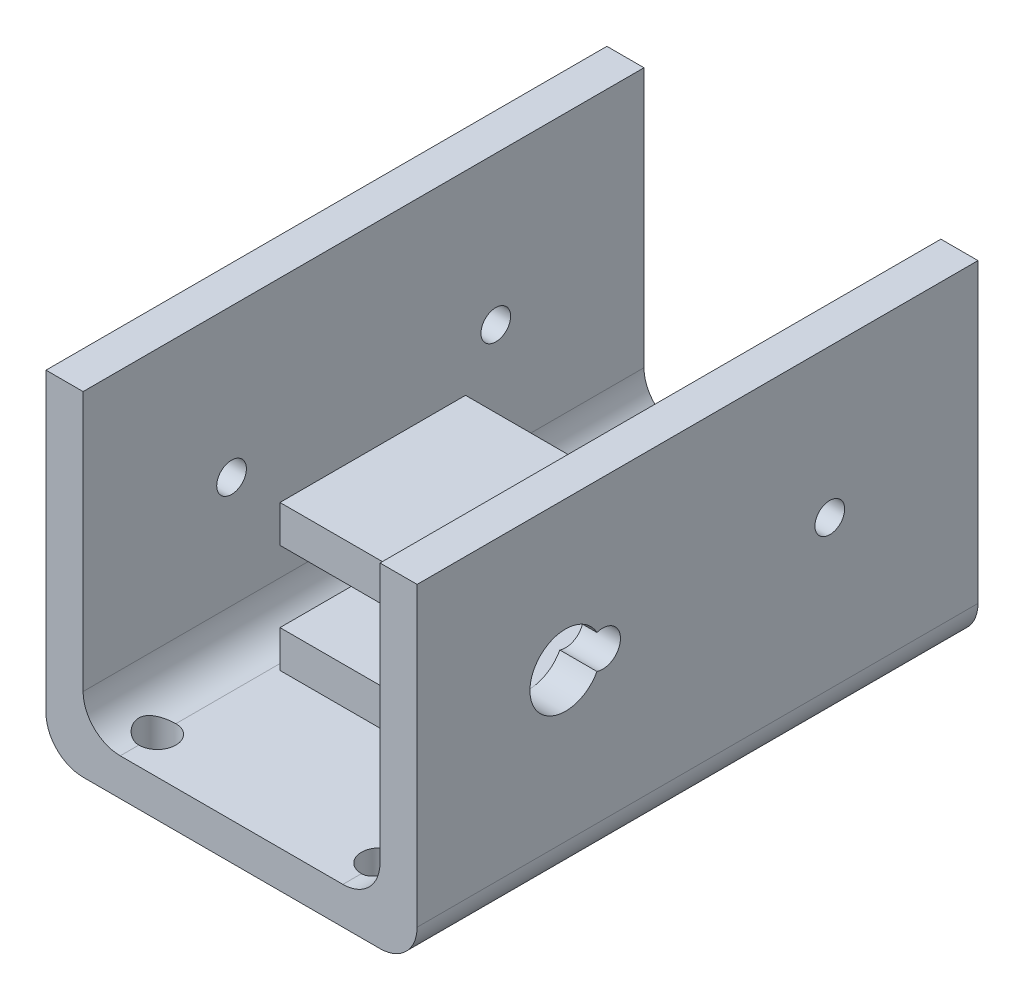
from build123d import *

# Parameters (mm, degrees)
SKETCH1_W           = 50.8
SKETCH1_H           = 95.972651844
SKETCH1_R           = 3.175
SKETCH1_R_2         = 3.81
BOSS_EXTRUDE1_DEPTH = 6.35
SKETCH1_3_W         = 6.35
SKETCH1_3_H         = 95.972651844
BOSS_EXTRUDE2_DEPTH = 57.15
FILLET1_R           = 6.35
SKETCH2_R           = 6.096
SKETCH2_R_2         = 2.54
SKETCH2_R_3         = 3.048
CUT_EXTRUDE1_DEPTH  = 6.35
CUT_EXTRUDE2_REACH  = 99.995
SKETCH2_4_R         = 2.54
SKETCH3_W           = 31.75
SKETCH3_H           = 6.35
BOSS_EXTRUDE4_DEPTH = 30.48


with BuildPart() as part:
    # Sketch1 → Boss-Extrude1 (new body)
    with BuildSketch(Plane(origin=(0, 0, 0), x_dir=(1, 0, 0), z_dir=(0, 1, 0))):
        with Locations((0, -0.019674078)):
            Rectangle(SKETCH1_W, SKETCH1_H)
        with Locations(Location((-19.05, -41.656, 0), (0, 0, 270))):
            Circle(SKETCH1_R, mode=Mode.SUBTRACT)
        with Locations(Location((19.05, -41.656, 0), (0, 0, 270))):
            Circle(SKETCH1_R, mode=Mode.SUBTRACT)
        with Locations(Location((-19.05, 41.616651844, 0), (0, 0, 270))):
            Circle(SKETCH1_R, mode=Mode.SUBTRACT)
        with Locations(Location((0, 0, 0), (0, 0, 270))):
            Circle(SKETCH1_R_2, mode=Mode.SUBTRACT)
        with Locations(Location((19.05, 41.616651844, 0), (0, 0, 270))):
            Circle(SKETCH1_R, mode=Mode.SUBTRACT)
    extrude(amount=BOSS_EXTRUDE1_DEPTH)

    # Sketch1<3> → Boss-Extrude2 (add)
    with BuildSketch(Plane(origin=(0, 0, 0), x_dir=(1, 0, 0), z_dir=(0, 1, 0))):
        with Locations((-28.575, -0.019674078)):
            Rectangle(SKETCH1_3_W, SKETCH1_3_H)
        with Locations((28.575, -0.019674078)):
            Rectangle(SKETCH1_3_W, SKETCH1_3_H)
    extrude(amount=BOSS_EXTRUDE2_DEPTH)

    # Fillet1
    # the kernel refuses this fillet: 6.35 mm, written as the material it adds along each edge
    with BuildSketch(Plane(origin=(25.4, 6.35, 48.006), x_dir=(0, 1, 0), z_dir=(0, 0, -1))) as fillet1_piece_1_section:
        with BuildLine():
            CenterArc((FILLET1_R, -FILLET1_R), FILLET1_R, 90, 90)
            Line((0, -FILLET1_R), (0, 0))
            Line((0, 0), (FILLET1_R, 0))
        make_face()
    fillet1_piece_1 = extrude(amount=95.972651844, mode=Mode.PRIVATE)
    fillet1_piece_1 = fillet1_piece_1 - Plane(origin=(19.05, 7.801972373, 41.656), x_dir=(0, 0, 1), z_dir=(0, -1, 0)) * Cylinder(3.175, 218, mode=Mode.PRIVATE)
    fillet1_piece_1 = fillet1_piece_1 - Plane(origin=(19.05, 7.801972373, -41.616651844), x_dir=(0, 0, 1), z_dir=(0, -1, 0)) * Cylinder(3.175, 218, mode=Mode.PRIVATE)
    add(fillet1_piece_1)
    with BuildSketch(Plane(origin=(-25.4, 6.35, -47.966651844), x_dir=(1, 0, 0), z_dir=(0, 0, 1))) as fillet1_piece_2_section:
        with BuildLine():
            CenterArc((FILLET1_R, FILLET1_R), FILLET1_R, 180, 90)
            Line((0, FILLET1_R), (0, 0))
            Line((0, 0), (FILLET1_R, 0))
        make_face()
    fillet1_piece_2 = extrude(amount=95.972651844, mode=Mode.PRIVATE)
    fillet1_piece_2 = fillet1_piece_2 - Plane(origin=(-19.05, 7.801971704, 41.656), x_dir=(0, 0, 1), z_dir=(0, -1, 0)) * Cylinder(3.175, 218, mode=Mode.PRIVATE)
    fillet1_piece_2 = fillet1_piece_2 - Plane(origin=(-19.05, 7.801971704, -41.616651844), x_dir=(0, 0, 1), z_dir=(0, -1, 0)) * Cylinder(3.175, 218, mode=Mode.PRIVATE)
    add(fillet1_piece_2)
    # the kernel refuses this fillet: 6.35 mm, written as the material it takes off along each edge
    with BuildSketch(Plane(origin=(-31.75, 0, -63.841651844), x_dir=(1, 0, 0), z_dir=(0, 0, 1)), Plane(origin=(31.75, 0, 63.881), x_dir=(-1, 0, 0), z_dir=(0, 0, -1))) as fillet1_2_piece_1:
        with BuildLine():
            CenterArc((FILLET1_R, FILLET1_R), FILLET1_R, 180, 90)
            Line((0, FILLET1_R), (0, 0))
            Line((0, 0), (FILLET1_R, 0))
        make_face()
    extrude(amount=127.722651844, mode=Mode.SUBTRACT)

    # Sketch2 → Cut-Extrude1 (cut)
    # profile 1 of 6: a face of its own
    with BuildSketch(Plane(origin=(31.75, 0, 0), x_dir=(0, 0, -1), z_dir=(1, 0, 0))):
        with Locations((-22.606, 31.75)):
            Circle(SKETCH2_R)
        with Locations((-22.606, 31.75)):
            Circle(SKETCH2_R_2, mode=Mode.SUBTRACT)
    # profile 2 of 6: a face of its own
    with BuildSketch(Plane(origin=(31.75, 0, 0), x_dir=(0, 0, -1), z_dir=(1, 0, 0))):
        with Locations((-22.606, 31.75)):
            Circle(SKETCH2_R_2)
    # profile 3 of 6: a face of its own
    with BuildSketch(Plane(origin=(31.75, 0, 0), x_dir=(0, 0, -1), z_dir=(1, 0, 0))):
        with Locations((-22.606, 31.75)):
            Circle(SKETCH2_R)
    # profile 4 of 6: a face of its own
    with BuildSketch(Plane(origin=(31.75, 0, 0), x_dir=(0, 0, -1), z_dir=(1, 0, 0))):
        with Locations((-16.256, 31.75)):
            Circle(SKETCH2_R_3)
    # profile 5 of 6: a face of its own
    with BuildSketch(Plane(origin=(31.75, 0, 0), x_dir=(0, 0, -1), z_dir=(1, 0, 0))):
        with Locations((-22.606, 31.75)):
            Circle(SKETCH2_R)
    # profile 6 of 6: a face of its own
    with BuildSketch(Plane(origin=(31.75, 0, 0), x_dir=(0, 0, -1), z_dir=(1, 0, 0))):
        with Locations((-16.256, 31.75)):
            Circle(SKETCH2_R_3)
    extrude(amount=-CUT_EXTRUDE1_DEPTH, mode=Mode.SUBTRACT)

    # Cut-Extrude2: up to this face of the body (flat: up to its plane)
    cut_extrude2_end = Plane(part.part.faces().sort_by_distance((-31.75, 31.75, 0.019674078))[0])
    # Sketch2<4> → Cut-Extrude2 (cut, up to the picked face)
    with BuildSketch(Plane(origin=(31.75, 0, 0), x_dir=(0, 0, -1), z_dir=(1, 0, 0)), mode=Mode.PRIVATE) as cut_extrude2_sk1:
        with Locations((22.606, 31.75)):
            Circle(SKETCH2_4_R)
    cut_extrude2_tool1 = split(extrude(cut_extrude2_sk1.sketch, amount=-CUT_EXTRUDE2_REACH, mode=Mode.PRIVATE), bisect_by=cut_extrude2_end, keep=Keep.BOTH, mode=Mode.PRIVATE)
    # Sketch2<4> → Cut-Extrude2 (cut, up to the picked face)
    with BuildSketch(Plane(origin=(31.75, 0, 0), x_dir=(0, 0, -1), z_dir=(1, 0, 0)), mode=Mode.PRIVATE) as cut_extrude2_sk2:
        with Locations((-22.606, 31.75)):
            Circle(SKETCH2_4_R)
    cut_extrude2_tool2 = split(extrude(cut_extrude2_sk2.sketch, amount=-CUT_EXTRUDE2_REACH, mode=Mode.PRIVATE), bisect_by=cut_extrude2_end, keep=Keep.BOTH, mode=Mode.PRIVATE)
    add(cut_extrude2_tool1.solids().sort_by(Axis((31.75, 31.75, -22.606), (-1, 0, 0)))[0], mode=Mode.SUBTRACT)
    add(cut_extrude2_tool2.solids().sort_by(Axis((31.75, 31.75, 22.606), (-1, 0, 0)))[0], mode=Mode.SUBTRACT)

    # Sketch3 → Boss-Extrude4 (add)
    with BuildSketch(Plane.ZY.offset(-25.4)):
        with Locations((18.766859732, 22.479)):
            Rectangle(SKETCH3_W, SKETCH3_H)
        with Locations((18.766859732, 41.021)):
            Rectangle(SKETCH3_W, SKETCH3_H)
    extrude(amount=BOSS_EXTRUDE4_DEPTH)


solid = part.part
